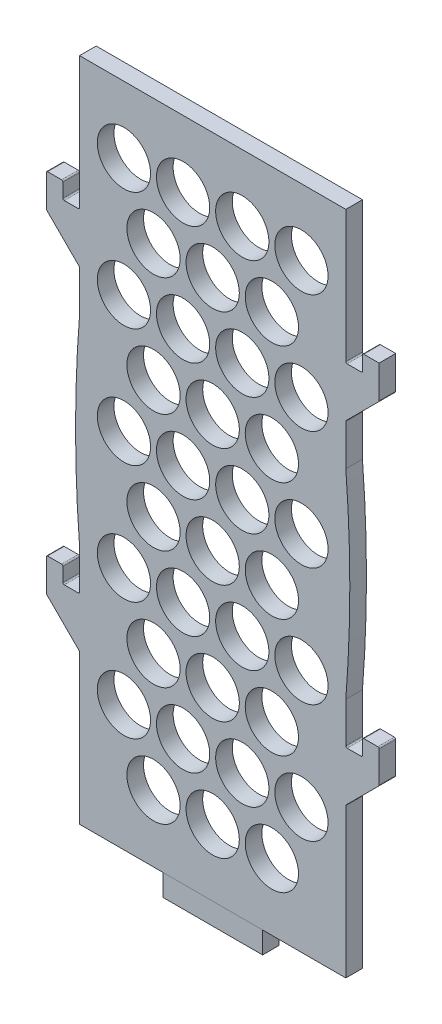
from build123d import *

# Parameters (mm, degrees)
SKETCH1_W           = 50.8
SKETCH1_H           = 127
BOSS_EXTRUDE1_DEPTH = 3.175
SKETCH2_R           = 5.08
CUT_EXTRUDE1_DEPTH  = 3.175
SKETCH3_W           = 19.05
SKETCH3_H           = 4.13278272
BOSS_EXTRUDE2_DEPTH = 3.175
BOSS_EXTRUDE3_DEPTH = 3.175
CHAMFER1_SIZE       = 3.175
CHAMFER2_SIZE       = 3.175
BOSS_EXTRUDE4_DEPTH = 3.175
FILLET1_START       = -1
FILLET1_DEPTH       = 5
FILLET1_2_DEPTH     = 3.175


with BuildPart() as part:
    # Sketch1 → Boss-Extrude1 (new body)
    with BuildSketch(Plane.XY):
        with Locations((25.4, 63.5)):
            Rectangle(SKETCH1_W, SKETCH1_H)
    extrude(amount=BOSS_EXTRUDE1_DEPTH)

    # Sketch2 → Cut-Extrude1 (cut)
    with BuildSketch(Plane.XY.offset(3.175)):
        with Locations(Location((8.466666667, 91.722222222, 0), (0, 0, 180))):
            Circle(SKETCH2_R)
        with Locations(Location((19.755555556, 91.722222222, 0), (0, 0, 180))):
            Circle(SKETCH2_R)
        with Locations(Location((31.044444444, 91.722222222, 0), (0, 0, 180))):
            Circle(SKETCH2_R)
        with Locations(Location((42.333333333, 91.722222222, 0), (0, 0, 180))):
            Circle(SKETCH2_R)
        with Locations(Location((14.111111111, 80.433333333, 0), (0, 0, 180))):
            Circle(SKETCH2_R)
        with Locations(Location((25.4, 80.433333333, 0), (0, 0, 180))):
            Circle(SKETCH2_R)
        with Locations(Location((36.688888889, 80.433333333, 0), (0, 0, 180))):
            Circle(SKETCH2_R)
        with Locations(Location((42.333333333, 69.144444444, 0), (0, 0, 180))):
            Circle(SKETCH2_R)
        with Locations(Location((31.044444444, 69.144444444, 0), (0, 0, 180))):
            Circle(SKETCH2_R)
        with Locations(Location((19.755555556, 69.144444444, 0), (0, 0, 180))):
            Circle(SKETCH2_R)
        with Locations(Location((8.466666667, 69.144444444, 0), (0, 0, 180))):
            Circle(SKETCH2_R)
        with Locations(Location((8.466666667, 23.988888889, 0), (0, 0, 180))):
            Circle(SKETCH2_R)
        with Locations(Location((19.755555556, 23.988888889, 0), (0, 0, 180))):
            Circle(SKETCH2_R)
        with Locations(Location((31.044444444, 23.988888889, 0), (0, 0, 180))):
            Circle(SKETCH2_R)
        with Locations((19.755555556, 114.3)):
            Circle(SKETCH2_R)
        with Locations((8.466666667, 114.3)):
            Circle(SKETCH2_R)
        with Locations((31.044444444, 114.3)):
            Circle(SKETCH2_R)
        with Locations((42.333333333, 114.3)):
            Circle(SKETCH2_R)
        with Locations((25.4, 103.011111111)):
            Circle(SKETCH2_R)
        with Locations((36.688888889, 103.011111111)):
            Circle(SKETCH2_R)
        with Locations((14.111111111, 103.011111111)):
            Circle(SKETCH2_R)
        with Locations(Location((42.333333333, 23.988888889, 0), (0, 0, 180))):
            Circle(SKETCH2_R)
        with Locations(Location((36.688888889, 35.277777778, 0), (0, 0, 180))):
            Circle(SKETCH2_R)
        with Locations(Location((25.4, 35.277777778, 0), (0, 0, 180))):
            Circle(SKETCH2_R)
        with Locations(Location((14.111111111, 35.277777778, 0), (0, 0, 180))):
            Circle(SKETCH2_R)
        with Locations((36.688888889, 57.855555556)):
            Circle(SKETCH2_R)
        with Locations((25.4, 57.855555556)):
            Circle(SKETCH2_R)
        with Locations((14.111111111, 57.855555556)):
            Circle(SKETCH2_R)
        with Locations((42.333333333, 46.566666667)):
            Circle(SKETCH2_R)
        with Locations((31.044444444, 46.566666667)):
            Circle(SKETCH2_R)
        with Locations((19.755555556, 46.566666667)):
            Circle(SKETCH2_R)
        with Locations((8.466666667, 46.566666667)):
            Circle(SKETCH2_R)
        with Locations((14.111111111, 12.7)):
            Circle(SKETCH2_R)
        with Locations((25.4, 12.7)):
            Circle(SKETCH2_R)
        with Locations((36.688888889, 12.7)):
            Circle(SKETCH2_R)
    extrude(amount=-CUT_EXTRUDE1_DEPTH, mode=Mode.SUBTRACT)

    # Sketch4 → Boss-Extrude3 (add)
    with BuildSketch(Plane.XY.offset(3.175)):
        Polygon((0, 101.6), (-3.175, 101.6), (-3.175, 104.775), (-6.35, 104.775), (-6.35, 98.425), (-3.175, 98.425), (-3.175, 92.075), (0, 92.075), align=None)
        Polygon((53.975, 104.775), (53.975, 101.6), (50.8, 101.6), (50.8, 92.075), (53.975, 92.075), (53.975, 98.425), (57.15, 98.425), (57.15, 104.775), align=None)
        Polygon((0, 38.1), (-3.175, 38.1), (-3.175, 41.275), (-6.35, 41.275), (-6.35, 34.925), (-3.175, 34.925), (-3.175, 28.575), (0, 28.575), align=None)
        Polygon((57.15, 34.925), (57.15, 41.275), (53.975, 41.275), (53.975, 38.1), (50.8, 38.1), (50.8, 28.575), (53.975, 28.575), (53.975, 34.925), align=None)
    extrude(amount=-BOSS_EXTRUDE3_DEPTH)

    # Chamfer1
    chamfer1_edges = [part.edges().sort_by_distance(p)[0] for p in [
        (-3.175, 98.425, 1.5875),
        (-3.175, 34.925, 1.5875),
        (53.975, 34.925, 1.5875),
        (53.975, 98.425, 1.5875),
    ]]
    chamfer(chamfer1_edges, length=CHAMFER1_SIZE - 0.0001)  # a hair under: the kernel refuses the full size

    # Chamfer2
    chamfer2_edges = [part.edges().sort_by_distance(p)[0] for p in [
        (-3.175, 28.575, 1.5875),
        (53.975, 28.575, 1.5875),
        (53.975, 92.075, 1.5875),
        (-3.175, 92.075, 1.5875),
    ]]
    chamfer(chamfer2_edges, length=CHAMFER2_SIZE - 0.0001)  # a hair under: the kernel refuses the full size

    # Sketch5 → Boss-Extrude4 (add)
    with BuildSketch(Plane.XY.offset(3.175)):
        with BuildLine():
            Line((0, 84.1375), (0, 46.0375))
            ThreePointArc((0, 46.0375), (-0.762, 65.0875), (0, 84.1375))
        make_face()
        with BuildLine():
            Line((50.8, 84.1375), (50.8, 46.0375))
            ThreePointArc((50.8, 46.0375), (51.562, 65.0875), (50.8, 84.1375))
        make_face()
    extrude(amount=-BOSS_EXTRUDE4_DEPTH)

    # Fillet1: read off the stored shape, not the designer's step
    # Fillet1 outline → Fillet1 (cut)
    with BuildSketch(Plane.XY.offset(FILLET1_START)):
        with BuildLine():
            Line((-3.175, 41.275), (-3.429, 41.275))
            ThreePointArc((-3.429, 41.275), (-3.249394878, 41.200605122), (-3.175, 41.021))
            Line((-3.175, 41.021), (-3.175, 41.275))
        make_face()
        with BuildLine():
            Line((-6.35, 41.275), (-6.35, 41.021))
            ThreePointArc((-6.35, 41.021), (-6.275605122, 41.200605122), (-6.096, 41.275))
            Line((-6.096, 41.275), (-6.35, 41.275))
        make_face()
        with BuildLine():
            ThreePointArc((-6.275605122, 34.850605122), (-6.330665401, 34.933008653), (-6.35, 35.030210245))
            Line((-6.35, 35.030210245), (-6.35, 34.925))
            Line((-6.35, 34.925), (-6.275605122, 34.850605122))
        make_face()
        with BuildLine():
            Line((57.15, 34.925), (57.15, 35.030210245))
            ThreePointArc((57.15, 35.030210245), (57.130665401, 34.933008653), (57.075605122, 34.850605122))
            Line((57.075605122, 34.850605122), (57.15, 34.925))
        make_face()
        with BuildLine():
            Line((57.15, 41.275), (56.896, 41.275))
            ThreePointArc((56.896, 41.275), (57.075605122, 41.200605122), (57.15, 41.021))
            Line((57.15, 41.021), (57.15, 41.275))
        make_face()
        with BuildLine():
            Line((53.975, 41.275), (53.975, 41.021))
            ThreePointArc((53.975, 41.021), (54.049394878, 41.200605122), (54.229, 41.275))
            Line((54.229, 41.275), (53.975, 41.275))
        make_face()
        with BuildLine():
            Line((57.15, 98.425), (57.15, 98.530210245))
            ThreePointArc((57.15, 98.530210245), (57.130665401, 98.433008653), (57.075605122, 98.350605122))
            Line((57.075605122, 98.350605122), (57.15, 98.425))
        make_face()
        with BuildLine():
            Line((53.975, 104.775), (53.975, 104.521))
            ThreePointArc((53.975, 104.521), (54.049394878, 104.700605122), (54.229, 104.775))
            Line((54.229, 104.775), (53.975, 104.775))
        make_face()
        with BuildLine():
            Line((-3.175, 104.775), (-3.429, 104.775))
            ThreePointArc((-3.429, 104.775), (-3.249394878, 104.700605122), (-3.175, 104.521))
            Line((-3.175, 104.521), (-3.175, 104.775))
        make_face()
        with BuildLine():
            Line((-6.35, 104.775), (-6.35, 104.521))
            ThreePointArc((-6.35, 104.521), (-6.275605122, 104.700605122), (-6.096, 104.775))
            Line((-6.096, 104.775), (-6.35, 104.775))
        make_face()
        with BuildLine():
            Line((-6.35, 98.425), (-6.275605122, 98.350605122))
            ThreePointArc((-6.275605122, 98.350605122), (-6.330665401, 98.433008653), (-6.35, 98.530210245))
            Line((-6.35, 98.530210245), (-6.35, 98.425))
        make_face()
    extrude(amount=FILLET1_DEPTH, mode=Mode.SUBTRACT)

    # Fillet1 2 outline → Fillet1 2 (add)
    with BuildSketch(Plane.XY):
        with BuildLine():
            Line((0, 28.575), (-0.074394878, 28.649394878))
            ThreePointArc((-0.074394878, 28.649394878), (-0.019334599, 28.566991347), (0, 28.469789755))
            Line((0, 28.469789755), (0, 28.575))
        make_face()
        with BuildLine():
            ThreePointArc((0, 38.354), (-0.074394878, 38.174394878), (-0.254, 38.1))
            Line((-0.254, 38.1), (0, 38.1))
            Line((0, 38.1), (0, 38.354))
        make_face()
        with BuildLine():
            ThreePointArc((-2.921, 38.1), (-3.100605122, 38.174394878), (-3.175, 38.354))
            Line((-3.175, 38.354), (-3.175, 38.1))
            Line((-3.175, 38.1), (-2.921, 38.1))
        make_face()
        with BuildLine():
            ThreePointArc((50.8, 28.469789755), (50.819334599, 28.566991347), (50.874394878, 28.649394878))
            Line((50.874394878, 28.649394878), (50.8, 28.575))
            Line((50.8, 28.575), (50.8, 28.469789755))
        make_face()
        with BuildLine():
            ThreePointArc((53.975, 38.354), (53.900605122, 38.174394878), (53.721, 38.1))
            Line((53.721, 38.1), (53.975, 38.1))
            Line((53.975, 38.1), (53.975, 38.354))
        make_face()
        with BuildLine():
            ThreePointArc((51.054, 38.1), (50.874394878, 38.174394878), (50.8, 38.354))
            Line((50.8, 38.354), (50.8, 38.1))
            Line((50.8, 38.1), (51.054, 38.1))
        make_face()
        with BuildLine():
            Line((53.975, 101.6), (53.975, 101.854))
            ThreePointArc((53.975, 101.854), (53.900605122, 101.674394878), (53.721, 101.6))
            Line((53.721, 101.6), (53.975, 101.6))
        make_face()
        with BuildLine():
            ThreePointArc((50.8, 91.969789755), (50.819334599, 92.066991347), (50.874394878, 92.149394878))
            Line((50.874394878, 92.149394878), (50.8, 92.075))
            Line((50.8, 92.075), (50.8, 91.969789755))
        make_face()
        with BuildLine():
            Line((50.8, 101.6), (51.054, 101.6))
            ThreePointArc((51.054, 101.6), (50.874394878, 101.674394878), (50.8, 101.854))
            Line((50.8, 101.854), (50.8, 101.6))
        make_face()
        with BuildLine():
            Line((0, 92.075), (-0.074394878, 92.149394878))
            ThreePointArc((-0.074394878, 92.149394878), (-0.019334599, 92.066991347), (0, 91.969789755))
            Line((0, 91.969789755), (0, 92.075))
        make_face()
        with BuildLine():
            ThreePointArc((0, 101.854), (-0.074394878, 101.674394878), (-0.254, 101.6))
            Line((-0.254, 101.6), (0, 101.6))
            Line((0, 101.6), (0, 101.854))
        make_face()
        with BuildLine():
            ThreePointArc((-2.921, 101.6), (-3.100605122, 101.674394878), (-3.175, 101.854))
            Line((-3.175, 101.854), (-3.175, 101.6))
            Line((-3.175, 101.6), (-2.921, 101.6))
        make_face()
    extrude(amount=FILLET1_2_DEPTH)


with BuildPart() as body_2:
    # Sketch3 → Boss-Extrude2 (new body)
    with BuildSketch(Plane.XY.offset(3.175)):
        with Locations((25.4, -2.06639136)):
            Rectangle(SKETCH3_W, SKETCH3_H)
    extrude(amount=-BOSS_EXTRUDE2_DEPTH)


solid = Compound([part.part, body_2.part])
